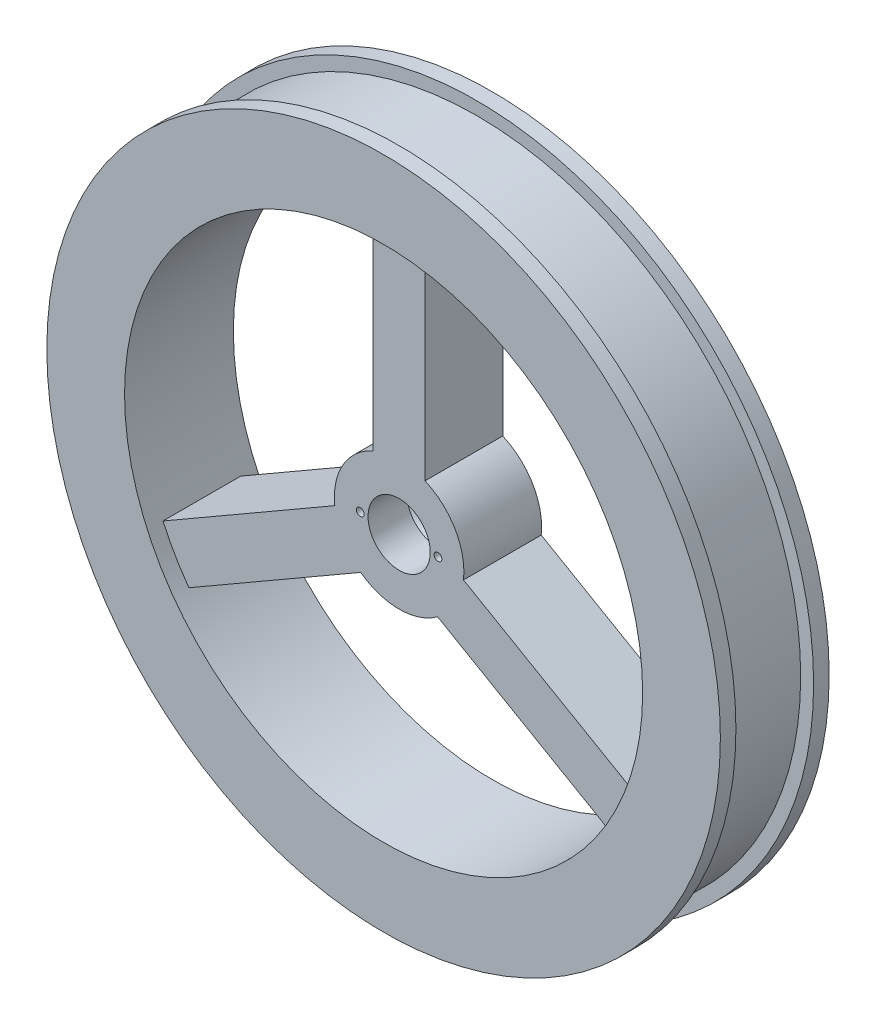
from build123d import *
from build123d.topology import SkipClean

# Parameters (mm, degrees)
SKETCH3_R           = 625
BOSS_EXTRUDE1_DEPTH = 150
SKETCH4_R           = 60
CUT_EXTRUDE1_DEPTH  = 897.521054
BOSS_EXTRUDE2_START = 32.5
SKETCH5_R           = 60
SKETCH5_R_2         = 55
BOSS_EXTRUDE2_DEPTH = 32.5
FILLET3_R           = 10
SKETCH6_R           = 7.5
CUT_EXTRUDE2_DEPTH  = 30
BOSS_EXTRUDE3_START = 30
SKETCH7_R           = 650
SKETCH7_R_2         = 500
BOSS_EXTRUDE3_DEPTH = 30


with BuildPart() as part:
    # Sketch3 → Boss-Extrude1 (new body)
    with BuildSketch(Plane.XY):
        Circle(SKETCH3_R)
        with BuildLine():
            Line((-50, 497.493719), (-50, 114.564392))
            ThreePointArc((-50, 114.564392), (-108.253175, 62.5), (-124.215674, -13.980926))
            Line((-124.215674, -13.980926), (-455.842198, -205.445589))
            ThreePointArc((-455.842198, -205.445589), (-433.012702, 250), (-50, 497.493719))
        make_face(mode=Mode.SUBTRACT)
        with BuildLine():
            Line((50, 497.493719), (50, 114.564392))
            ThreePointArc((50, 114.564392), (108.253175, 62.5), (124.215674, -13.980926))
            Line((124.215674, -13.980926), (455.842198, -205.445589))
            ThreePointArc((455.842198, -205.445589), (433.012702, 250), (50, 497.493719))
        make_face(mode=Mode.SUBTRACT)
        with BuildLine():
            Line((-74.215674, -100.583466), (-405.842198, -292.048129))
            ThreePointArc((-405.842198, -292.048129), (0, -500), (405.842198, -292.048129))
            Line((405.842198, -292.048129), (74.215674, -100.583466))
            ThreePointArc((74.215674, -100.583466), (0, -125), (-74.215674, -100.583466))
        make_face(mode=Mode.SUBTRACT)
    extrude(amount=BOSS_EXTRUDE1_DEPTH)

    # Sketch4 → Cut-Extrude1 (cut, through all)
    with BuildSketch(Plane(origin=(0, 0, 0), x_dir=(-1, 0, 0), z_dir=(0, 0, -1))):
        Circle(SKETCH4_R)
    extrude(amount=-CUT_EXTRUDE1_DEPTH, mode=Mode.SUBTRACT)

    # Sketch5 → Boss-Extrude2 (add)
    with BuildSketch(Plane(origin=(0, 0, 75), x_dir=(-1, 0, 0), z_dir=(0, 0, -1)).offset(BOSS_EXTRUDE2_START)):
        Circle(SKETCH5_R)
        Circle(SKETCH5_R_2, mode=Mode.SUBTRACT)
    extrude(amount=-BOSS_EXTRUDE2_DEPTH)

    # Fillet3
    # the kernel refuses this fillet: 10 mm, written as the material it takes off along each edge
    with BuildSketch(Plane(origin=(0, 0, 75), x_dir=(-1, 0, 0), z_dir=(0, -1, 0))) as fillet3_piece_1:
        with BuildLine():
            CenterArc((65, 8.660254), FILLET3_R, 180, 60)
            Line((55, 8.660254), (54.8, 8.660254))
            Line((54.8, 8.660254), (54.8, 0))
            Line((54.8, 0), (55, -0.2))
            ThreePointArc((55, -0.2), (57.5, -0.2), (59.9, -0.173205))
            Line((59.9, -0.173205), (60, 0))
        make_face()
    revolve(axis=Axis((0, 0, 75), (0, 0, -1)), mode=Mode.SUBTRACT)

    # Sketch6 → Cut-Extrude2 (cut)
    with BuildSketch(Plane(origin=(0, 0, 0), x_dir=(-1, 0, 0), z_dir=(0, 0, -1))):
        with Locations((-75, 0)):
            Circle(SKETCH6_R)
        with Locations((75, 0)):
            Circle(SKETCH6_R)
    cut_extrude2 = extrude(amount=-CUT_EXTRUDE2_DEPTH, mode=Mode.SUBTRACT)

    # Mirror1: Cut-Extrude2 across plane
    add(cut_extrude2.mirror(Plane(origin=(0, 0, 75), x_dir=(1, 0, 0), z_dir=(0, 0, -1))), mode=Mode.SUBTRACT)

    # Sketch7 → Boss-Extrude3 (add)
    with BuildSketch(Plane(origin=(0, 0, 0), x_dir=(-1, 0, 0), z_dir=(0, 0, -1)).offset(BOSS_EXTRUDE3_START)):
        Circle(SKETCH7_R)
        Circle(SKETCH7_R_2, mode=Mode.SUBTRACT)
    boss_extrude3 = extrude(amount=-BOSS_EXTRUDE3_DEPTH)

    # Mirror2: Boss-Extrude3 across plane
    with SkipClean():  # the faces are left unmerged after this step: merging them gives an invalid solid
        add(boss_extrude3.mirror(Plane(origin=(0, 0, 75), x_dir=(1, 0, 0), z_dir=(0, 0, -1))))


solid = part.part
